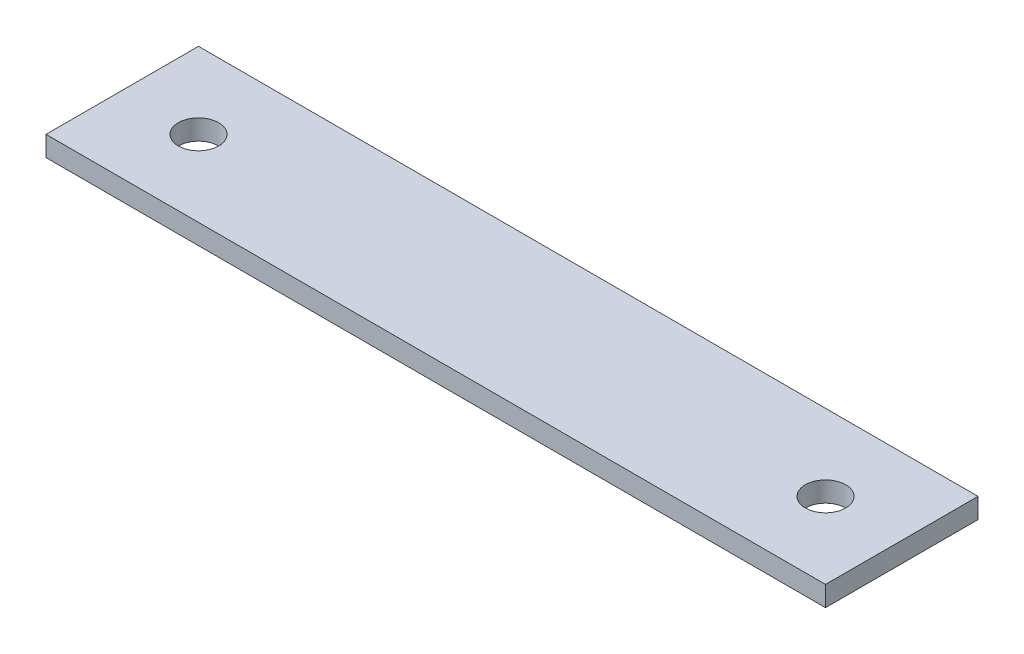
from build123d import *

# Parameters (mm, degrees)
SKETCH1_W           = 61.344
SKETCH1_H           = 12
SKETCH1_R           = 1.5875
BOSS_EXTRUDE1_DEPTH = 0.79375


with BuildPart() as part:
    # Sketch1 → Boss-Extrude1 (new, symmetric)
    with BuildSketch(Plane(origin=(0, 0, 0), x_dir=(1, 0, 0), z_dir=(0, 1, 0))):
        Rectangle(SKETCH1_W, SKETCH1_H)
        with Locations((-24.672, 0)):
            Circle(SKETCH1_R, mode=Mode.SUBTRACT)
        with Locations((24.672, 0)):
            Circle(SKETCH1_R, mode=Mode.SUBTRACT)
    extrude(amount=BOSS_EXTRUDE1_DEPTH, both=True)


solid = part.part
